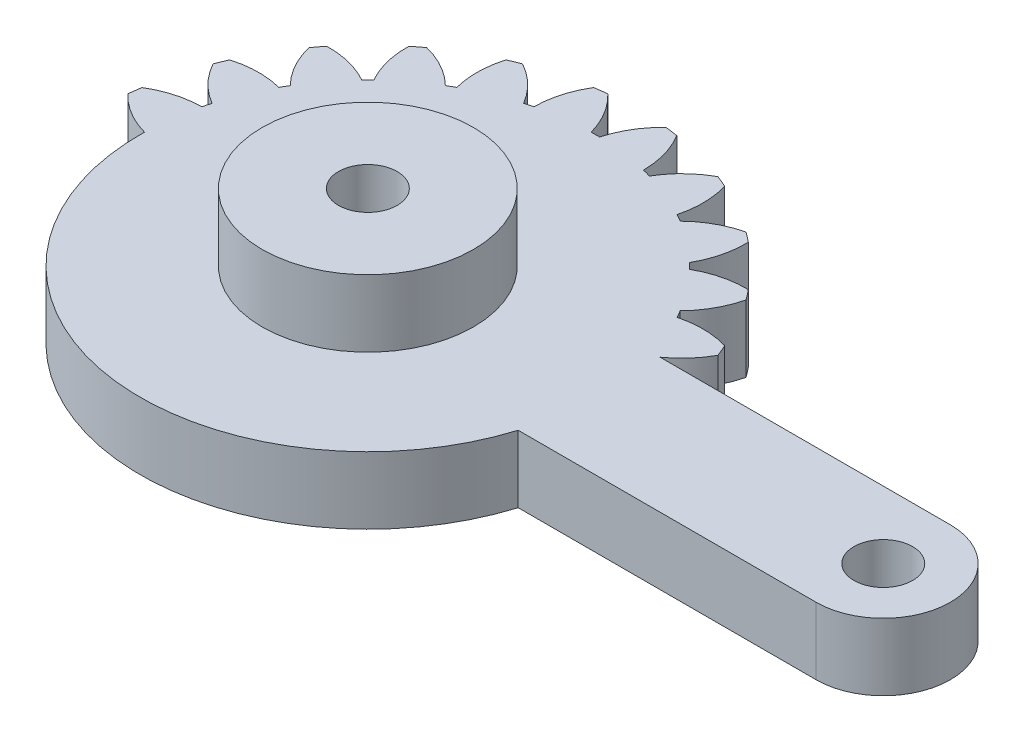
from build123d import *

# Parameters (mm, degrees)
IZIM2_R                     = 16.13
IZIM2_R_2                   = 1.75
IZIM2_R_3                   = 1.3
IZIM2_R_4                   = 1.29986265
Y_KSEKLIK_EKSTR_ZYON1_DEPTH = 4
KES_EKSTR_ZYON2_DEPTH       = 4
DAIRESEL_KAPLAMA2_COUNT     = 24
IZIM4_R                     = 1.75
Y_KSEKLIK_EKSTR_ZYON2_DEPTH = 4
KES_EKSTR_ZYON3_DEPTH       = 4
IZIM7_R                     = 6.29986265
IZIM7_R_2                   = 1.75
Y_KSEKLIK_EKSTR_ZYON3_DEPTH = 8


with BuildPart() as part:
    # Çizim2 → Yükseklik-Ekstrüzyon1 (new body)
    with BuildSketch(Plane(origin=(0, 0, 0), x_dir=(1, 0, 0), z_dir=(0, 1, 0))):
        Circle(IZIM2_R)
        Circle(IZIM2_R_2, mode=Mode.SUBTRACT)
        with Locations((5, 0)):
            Circle(IZIM2_R_3, mode=Mode.SUBTRACT)
        with Locations((-5, 0)):
            Circle(IZIM2_R_4, mode=Mode.SUBTRACT)
    extrude(amount=Y_KSEKLIK_EKSTR_ZYON1_DEPTH)

    # Çizim1 → Kes-Ekstrüzyon2 (cut)
    with BuildSketch(Plane(origin=(0, 0, 0), x_dir=(1, 0, 0), z_dir=(0, 1, 0))):
        with BuildLine():
            ThreePointArc((0.25, 13.562696082), (0.821724337, 14.900419859), (1.729803678, 16.036978495))
            ThreePointArc((1.729803678, 16.036978495), (0, 16.13), (-1.729803678, 16.036978495))
            ThreePointArc((-1.729803678, 16.036978495), (-0.821724337, 14.900419859), (-0.25, 13.562696082))
            ThreePointArc((-0.25, 13.562696082), (-0.125005308, 13.564424008), (0, 13.565))
            ThreePointArc((0, 13.565), (0.125005308, 13.564424008), (0.25, 13.562696082))
        make_face()
    kes_ekstr_zyon2 = extrude(amount=KES_EKSTR_ZYON2_DEPTH, mode=Mode.SUBTRACT)

    # Dairesel Kaplama2: Kes-Ekstrüzyon2 ×24 about axis
    dairesel_kaplama2_axis = Axis((0, 4, 0), (0, 1, 0))
    for i in range(1, DAIRESEL_KAPLAMA2_COUNT):
        add(kes_ekstr_zyon2.rotate(dairesel_kaplama2_axis, i * 360 / DAIRESEL_KAPLAMA2_COUNT), mode=Mode.SUBTRACT)

    # Çizim4 → Yükseklik-Ekstrüzyon2 (add)
    with BuildSketch(Plane(origin=(0, 0, 0), x_dir=(1, 0, 0), z_dir=(0, 1, 0))):
        with BuildLine():
            Line((11.382628211, 4), (22.858544508, 4))
            Line((22.858544508, 4), (30.722628211, 4))
            ThreePointArc((30.722628211, 4), (34.722628211, 0), (30.722628211, -4))
            Line((30.722628211, -4), (22.391671269, -4))
            Line((22.391671269, -4), (11.382628211, -4))
            ThreePointArc((11.382628211, -4), (12.065, 0), (11.382628211, 4))
        make_face()
        with Locations((30.722628211, 0)):
            Circle(IZIM4_R, mode=Mode.SUBTRACT)
    extrude(amount=Y_KSEKLIK_EKSTR_ZYON2_DEPTH)

    # Çizim5 → Kes-Ekstrüzyon3 (cut)
    with BuildSketch(Plane(origin=(0, 0, 0), x_dir=(1, 0, 0), z_dir=(0, 1, 0))):
        with BuildLine():
            Line((-13.565, 0), (-18.52935314, 0))
            Line((-18.52935314, 0), (-18.52935314, -18.21120255))
            Line((-18.52935314, -18.21120255), (15.661629934, -18.576881513))
            Line((15.661629934, -18.576881513), (15.661629934, -4))
            Line((15.661629934, -4), (12.961837254, -4))
            ThreePointArc((12.961837254, -4), (-2.022610028, -13.413361759), (-13.565, 0))
        make_face()
    extrude(amount=KES_EKSTR_ZYON3_DEPTH, mode=Mode.SUBTRACT)

    # Çizim7 → Yükseklik-Ekstrüzyon3 (add)
    with BuildSketch(Plane(origin=(0, 0, 0), x_dir=(1, 0, 0), z_dir=(0, 1, 0))):
        Circle(IZIM7_R)
        Circle(IZIM7_R_2, mode=Mode.SUBTRACT)
    extrude(amount=Y_KSEKLIK_EKSTR_ZYON3_DEPTH)


solid = part.part
